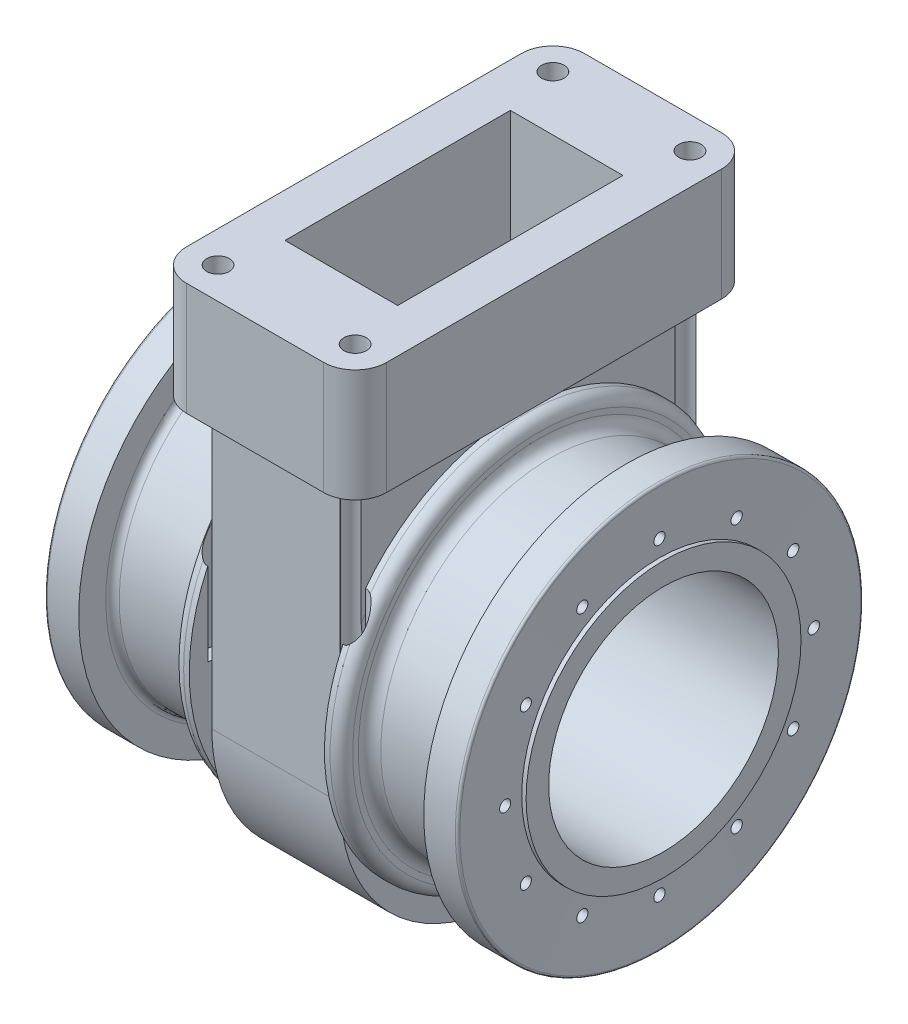
from build123d import *
from build123d.topology import SkipClean

# Parameters (mm, degrees)
SKETCH4_R                = 122
BOSS_EXTRUDE1_DEPTH      = 6
CUT_EXTRUDE2_DEPTH       = 444.448388743
CUT_EXTRUDE2_DEPTH_BACK  = 444.448388743
SKETCH5_R                = 102
BOSS_EXTRUDE2_START      = -6
SKETCH7_R                = 122
BOSS_EXTRUDE2_DEPTH      = 6
CUT_EXTRUDE5_DEPTH       = 6
CUT_EXTRUDE5_DEPTH_BACK  = 451.759359384
SKETCH8_R                = 102
SKETCH9_R                = 5
CUT_EXTRUDE7_DEPTH       = 316.271311844
CIRPATTERN1_COUNT        = 12
FILLET1_R                = 6
BOSS_EXTRUDE3_DEPTH      = 200
BOSS_EXTRUDE3_DEPTH_BACK = 200
SKETCH10_W               = 114
SKETCH10_H               = 316
BOSS_EXTRUDE4_DEPTH      = 100
FILLET3_R                = 150
FILLET4_R                = 150
SKETCH13_W               = 100
SKETCH13_H               = 200
CUT_EXTRUDE12_DEPTH      = 300
CUT_EXTRUDE14_DEPTH      = 426.968308723
CUT_EXTRUDE14_DEPTH_BACK = 426.968308723
SKETCH18_R               = 102
FILLET10_R               = 10
FILLET11_R               = 10
SKETCH19_R               = 175
BOSS_EXTRUDE10_DEPTH     = 15
FILLET14_R               = 10
CUT_EXTRUDE15_DEPTH      = 397.227207592
CUT_EXTRUDE15_DEPTH_BACK = 397.227207592
SKETCH20_R               = 102
CUT_EXTRUDE16_REACH      = 398.227
SKETCH22_R               = 10


with BuildPart() as part:
    # Sketch1 → Revolve4 (revolve)
    with BuildSketch(Plane.XY):
        with BuildLine():
            Line((-180, 0), (180, 0))
            Line((180, 0), (183.106392291, 177.965095187))
            ThreePointArc((183.106392291, 177.965095187), (182.533197799, 179.401818529), (181.106696901, 180))
            Line((181.106696901, 180), (153.141911687, 180))
            Line((153.141911687, 180), (153.141911687, 150))
            Line((153.141911687, 150), (-153.141911687, 150))
            Line((-153.141911687, 150), (-153.141911687, 180))
            Line((-153.141911687, 180), (-181.106696901, 180))
            ThreePointArc((-181.106696901, 180), (-182.533197799, 179.401818529), (-183.106392291, 177.965095187))
            Line((-183.106392291, 177.965095187), (-180, 0))
        make_face()
    revolve(axis=Axis((-180, 0, 0), (1, 0, 0)))

    # Sketch4 → Boss-Extrude1 (add)
    with BuildSketch(Plane(origin=(180, 0, 0), x_dir=(0, 0, -1), z_dir=(1, 0, 0))):
        Circle(SKETCH4_R)
    extrude(amount=BOSS_EXTRUDE1_DEPTH)

    # Sketch5 → Cut-Extrude2 (cut, two sides: drawn at the far end of the back side and taken through both)
    with BuildSketch(Plane(origin=(180, 0, 0), x_dir=(0, 0, -1), z_dir=(1, 0, 0)).offset(-CUT_EXTRUDE2_DEPTH_BACK)):
        Circle(SKETCH5_R)
    extrude(amount=CUT_EXTRUDE2_DEPTH + CUT_EXTRUDE2_DEPTH_BACK, mode=Mode.SUBTRACT)

    # Sketch7 → Boss-Extrude2 (add)
    with BuildSketch(Plane(origin=(-180, 0, 0), x_dir=(0, 0, -1), z_dir=(1, 0, 0)).offset(BOSS_EXTRUDE2_START)):
        Circle(SKETCH7_R)
    extrude(amount=BOSS_EXTRUDE2_DEPTH)

    # Sketch8 → Cut-Extrude5 (cut, two sides: drawn at the far end of the back side and taken through both)
    with SkipClean():  # the faces are left unmerged after this step: merging them gives an invalid solid
        with BuildSketch(Plane.ZY.offset(186).offset(-CUT_EXTRUDE5_DEPTH_BACK)):
            Circle(SKETCH8_R)
        extrude(amount=CUT_EXTRUDE5_DEPTH + CUT_EXTRUDE5_DEPTH_BACK, mode=Mode.SUBTRACT)
    add(part.part.scale(1), mode=Mode.REPLACE)  # the faces are merged on a copy

    # Sketch9 → Cut-Extrude7 (cut, symmetric)
    with BuildSketch(Plane(origin=(0, 0, 0), x_dir=(0, 0, -1), z_dir=(1, 0, 0))):
        with Locations((0, 137)):
            Circle(SKETCH9_R)
    cut_extrude7 = extrude(amount=CUT_EXTRUDE7_DEPTH, both=True, mode=Mode.SUBTRACT)

    # CirPattern1: Cut-Extrude7 ×12 about axis
    cirpattern1_axis = Axis((-183.106696901, 0, 0), (1, 0, 0))
    for i in range(1, CIRPATTERN1_COUNT):
        add(cut_extrude7.rotate(cirpattern1_axis, i * 360 / CIRPATTERN1_COUNT), mode=Mode.SUBTRACT)

    # Fillet1
    fillet1_edges = [part.edges().sort_by_distance(p)[0] for p in [
        (-153.141911687, -150, 0),
        (153.141911687, -150, 0),
    ]]
    fillet(fillet1_edges, radius=FILLET1_R)

    # Sketch10 → Boss-Extrude3 (add, two sides: drawn at the far end of the back side and taken through both)
    with BuildSketch(Plane(origin=(0, 0, 0), x_dir=(1, 0, 0), z_dir=(0, 1, 0)).offset(-BOSS_EXTRUDE3_DEPTH_BACK)):
        Rectangle(SKETCH10_W, SKETCH10_H)
    extrude(amount=BOSS_EXTRUDE3_DEPTH + BOSS_EXTRUDE3_DEPTH_BACK)

    # Sketch12 → Boss-Extrude4 (add)
    with BuildSketch(Plane(origin=(0, 200, 0), x_dir=(1, 0, 0), z_dir=(0, 1, 0))):
        with BuildLine():
            Line((-60.845432819, -176.608959801), (60.845432819, -176.608959801))
            ThreePointArc((60.845432819, -176.608959801), (80.644422692, -168.407949675), (88.845432819, -148.608959801))
            Line((88.845432819, -148.608959801), (88.845432819, 148.608959801))
            ThreePointArc((88.845432819, 148.608959801), (80.644422692, 168.407949675), (60.845432819, 176.608959801))
            Line((60.845432819, 176.608959801), (-60.845432819, 176.608959801))
            ThreePointArc((-60.845432819, 176.608959801), (-80.644422692, 168.407949675), (-88.845432819, 148.608959801))
            Line((-88.845432819, 148.608959801), (-88.845432819, -148.608959801))
            ThreePointArc((-88.845432819, -148.608959801), (-80.644422692, -168.407949675), (-60.845432819, -176.608959801))
        make_face()
    extrude(amount=BOSS_EXTRUDE4_DEPTH)

    # Fillet3
    fillet3_edges = [part.edges().sort_by_distance(p)[0] for p in [
        (0, -200, 158),
    ]]
    fillet(fillet3_edges, radius=FILLET3_R)

    # Fillet4
    fillet4_edges = [part.edges().sort_by_distance(p)[0] for p in [
        (0, -200, -158),
    ]]
    fillet(fillet4_edges, radius=FILLET4_R)

    # Sketch13 → Cut-Extrude12 (cut)
    with BuildSketch(Plane(origin=(0, 300, 0), x_dir=(1, 0, 0), z_dir=(0, 1, 0))):
        Rectangle(SKETCH13_W, SKETCH13_H)
    extrude(amount=-CUT_EXTRUDE12_DEPTH, mode=Mode.SUBTRACT)

    # Sketch18 → Cut-Extrude14 (cut, two sides: drawn at the far end of the back side and taken through both)
    with SkipClean():  # the faces are left unmerged after this step: merging them gives an invalid solid
        with BuildSketch(Plane(origin=(57, 0, 0), x_dir=(0, 0, -1), z_dir=(1, 0, 0)).offset(-CUT_EXTRUDE14_DEPTH_BACK)):
            Circle(SKETCH18_R)
        extrude(amount=CUT_EXTRUDE14_DEPTH + CUT_EXTRUDE14_DEPTH_BACK, mode=Mode.SUBTRACT)
    add(part.part.scale(1), mode=Mode.REPLACE)  # the faces are merged on a copy

    # Fillet10
    fillet10_edges = [part.edges().sort_by_distance(p)[0] for p in [
        (57, -150, 0),
    ]]
    fillet(fillet10_edges, radius=FILLET10_R)

    # Fillet11
    fillet11_edges = [part.edges().sort_by_distance(p)[0] for p in [
        (-57, -150, 0),
    ]]
    fillet(fillet11_edges, radius=FILLET11_R)

    # Sketch19 → Boss-Extrude10 (add)
    with BuildSketch(Plane(origin=(60, 0, 0), x_dir=(0, 0, -1), z_dir=(1, 0, 0))):
        Circle(SKETCH19_R)
    boss_extrude10 = extrude(amount=BOSS_EXTRUDE10_DEPTH)

    # Mirror4: Boss-Extrude10 across plane
    with SkipClean():  # the faces are left unmerged after this step: merging them gives an invalid solid
        add(boss_extrude10.mirror(Plane(origin=(0, 0, 0), x_dir=(0, 0, 1), z_dir=(1, 0, 0))))

    # Fillet14
    fillet14_edges = [part.edges().sort_by_distance(p)[0] for p in [
        (75, -150, 0),
        (75, 0, 175),
        (-75, -150, 0),
        (-75, 0, 175),
    ]]
    fillet(fillet14_edges, radius=FILLET14_R)

    # Sketch20 → Cut-Extrude15 (cut, two sides: drawn at the far end of the back side and taken through both)
    with SkipClean():  # the faces are left unmerged after this step: merging them gives an invalid solid
        with BuildSketch(Plane(origin=(0, 0, 0), x_dir=(0, 0, -1), z_dir=(1, 0, 0)).offset(-CUT_EXTRUDE15_DEPTH_BACK)):
            Circle(SKETCH20_R)
        extrude(amount=CUT_EXTRUDE15_DEPTH + CUT_EXTRUDE15_DEPTH_BACK, mode=Mode.SUBTRACT)

    # Sketch22 → Cut-Extrude16 (cut, up to next)
    with BuildSketch(Plane(origin=(0, 0, 0), x_dir=(1, 0, 0), z_dir=(0, 1, 0)), mode=Mode.PRIVATE) as cut_extrude16_sk1:
        with Locations((60.845432819, 148.608959801)):
            Circle(SKETCH22_R)
    cut_extrude16_tool1 = extrude(cut_extrude16_sk1.sketch, amount=CUT_EXTRUDE16_REACH, mode=Mode.PRIVATE) & part.part
    # Sketch22 → Cut-Extrude16 (cut, up to next)
    with BuildSketch(Plane(origin=(0, 0, 0), x_dir=(1, 0, 0), z_dir=(0, 1, 0)), mode=Mode.PRIVATE) as cut_extrude16_sk2:
        with Locations((60.845432819, -148.608959801)):
            Circle(SKETCH22_R)
    cut_extrude16_tool2 = extrude(cut_extrude16_sk2.sketch, amount=CUT_EXTRUDE16_REACH, mode=Mode.PRIVATE) & part.part
    # Sketch22 → Cut-Extrude16 (cut, up to next)
    with BuildSketch(Plane(origin=(0, 0, 0), x_dir=(1, 0, 0), z_dir=(0, 1, 0)), mode=Mode.PRIVATE) as cut_extrude16_sk3:
        with Locations((-60.845432819, -148.608959801)):
            Circle(SKETCH22_R)
    cut_extrude16_tool3 = extrude(cut_extrude16_sk3.sketch, amount=CUT_EXTRUDE16_REACH, mode=Mode.PRIVATE) & part.part
    # Sketch22 → Cut-Extrude16 (cut, up to next)
    with BuildSketch(Plane(origin=(0, 0, 0), x_dir=(1, 0, 0), z_dir=(0, 1, 0)), mode=Mode.PRIVATE) as cut_extrude16_sk4:
        with Locations((-60.845432819, 148.608959801)):
            Circle(SKETCH22_R)
    cut_extrude16_tool4 = extrude(cut_extrude16_sk4.sketch, amount=CUT_EXTRUDE16_REACH, mode=Mode.PRIVATE) & part.part
    add(cut_extrude16_tool1.solids().sort_by_distance((60.845433, 0, -148.60896))[0], mode=Mode.SUBTRACT)
    add(cut_extrude16_tool2.solids().sort_by_distance((60.845433, 0, 148.60896))[0], mode=Mode.SUBTRACT)
    add(cut_extrude16_tool3.solids().sort_by_distance((-60.845433, 0, 148.60896))[0], mode=Mode.SUBTRACT)
    add(cut_extrude16_tool4.solids().sort_by_distance((-60.845433, 0, -148.60896))[0], mode=Mode.SUBTRACT)


solid = part.part
